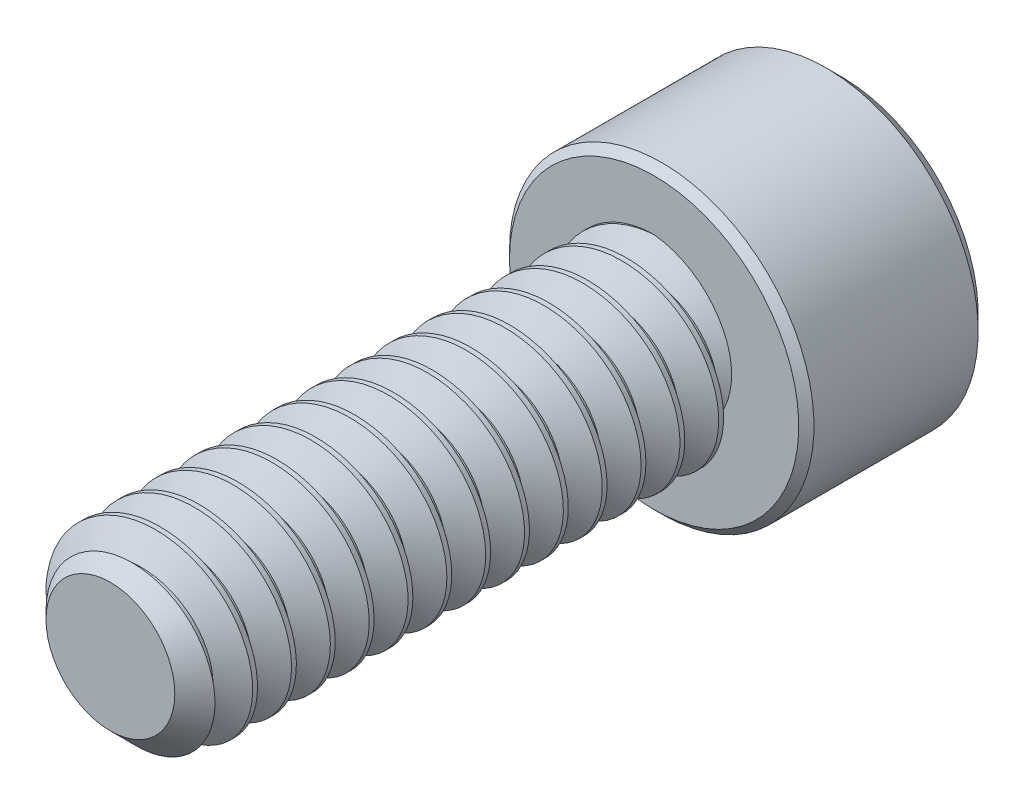
from build123d import *

# Parameters (mm, degrees)
SKETCH1_R          = 1.0922
EXTRUDE1_DEPTH     = 6.35
CHAMFER3_SIZE      = 0.340178571
CUT_SWEEP1_PITCH   = 0.453571429
SKETCH6_R          = 1.778
EXTRUDE2_DEPTH     = 2.1844
CUT_EXTRUDE1_DEPTH = 1.48828125
CHAMFER1_SIZE      = 0.1778
CHAMFER2_SIZE      = 0.0889


with BuildPart() as part:
    # Sketch1 → Extrude1 (new body)
    with BuildSketch(Plane.XY):
        Circle(SKETCH1_R)
    extrude(amount=-EXTRUDE1_DEPTH)

    # Chamfer3
    chamfer3_edges = [part.edges().sort_by_distance(p)[0] for p in [
        (-1.0922, 0, 0),
    ]]
    chamfer(chamfer3_edges, length=CHAMFER3_SIZE)

    # Cut-Sweep1: the profile of Sketch3 profile screwed along a right-hand helix of 15 turns, 6 arcs to a turn; built about Z, then put on its axis
    cut_sweep1_z = Axis((0, 0, 0), (0, 0, 1))
    cut_sweep1_corners = [(1.0925, 0, -0.397048205), (0.797596715, 0, -0.226785714), (0.797596715, 0, -0.170089286), (1.0925, 0, 0.000173205)]
    with BuildLine(mode=Mode.PRIVATE) as cut_sweep1_profile:
        Line(cut_sweep1_corners[0], cut_sweep1_corners[1])
        Line(cut_sweep1_corners[1], cut_sweep1_corners[2])
        Line(cut_sweep1_corners[2], cut_sweep1_corners[3])
        Line(cut_sweep1_corners[3], cut_sweep1_corners[0])
    cut_sweep1_cap = Face(cut_sweep1_profile.wire())
    cut_sweep1_turn_angles = [0, 30, 60, 90, 120, 150, 180, 210, 240, 270, 300, 330, 360]
    cut_sweep1_turn_weights = [1, 0.8660254037844387, 1, 0.8660254037844387, 1, 0.8660254037844387, 1, 0.8660254037844387, 1, 0.8660254037844387, 1, 0.8660254037844387, 1]
    cut_sweep1_turn_rails = [Edge.make_bspline([Vector(p[0], p[1], 0).rotate(cut_sweep1_z, cut_sweep1_turn_angles[k]) / cut_sweep1_turn_weights[k] + Vector(0, 0, p[2] + CUT_SWEEP1_PITCH * cut_sweep1_turn_angles[k] / 360) for k in range(13)], [0, 0, 0, 1, 1, 2, 2, 3, 3, 4, 4, 5, 5, 6, 6, 6], 2, cut_sweep1_turn_weights) for p in cut_sweep1_corners]
    cut_sweep1_turn_sides = [Face.make_surface_from_curves(cut_sweep1_turn_rails[p[0]], cut_sweep1_turn_rails[p[1]]) for p in [(0, 1), (1, 2), (2, 3), (3, 0)]]
    cut_sweep1 = Plane(origin=(0, 0, 0), x_dir=(0, 1, 0), z_dir=(0, 0, -1)) * Solid(Shell([*[p.moved(Location((0, 0, CUT_SWEEP1_PITCH * i))) for i in range(15) for p in cut_sweep1_turn_sides], cut_sweep1_cap, cut_sweep1_cap.rotate(cut_sweep1_z, 5400).moved(Location((0, 0, CUT_SWEEP1_PITCH * 5400 / 360)))]))
    add(cut_sweep1, mode=Mode.SUBTRACT)

    # Sketch6 → Extrude2 (add)
    with BuildSketch(Plane(origin=(0, 0, -6.35), x_dir=(-1, 0, 0), z_dir=(0, 0, -1))):
        Circle(SKETCH6_R)
    extrude(amount=EXTRUDE2_DEPTH)

    # Sketch7 → Cut-Extrude1 (cut)
    with BuildSketch(Plane(origin=(0, 0, -8.5344), x_dir=(-1, 0, 0), z_dir=(0, 0, -1))):
        Polygon((0, 1.14567944), (-0.9921875, 0.57283972), (-0.9921875, -0.57283972), (0, -1.14567944), (0.9921875, -0.57283972), (0.9921875, 0.57283972), align=None)
    extrude(amount=-CUT_EXTRUDE1_DEPTH, mode=Mode.SUBTRACT)

    # Cut-Extrude2 cone 1 section (through the dimple's axis) → Cut-Extrude2 (revolve, cut)
    with BuildSketch(Plane(origin=(0, 0, -8.5344), x_dir=(0, 1, 0), z_dir=(1, 0, 0))):
        Polygon((0, 0), (1.14567944, 0), (0, 1.14567944), align=None)
    revolve(axis=Axis((0, 0, -8.5344), (0, 0, 1)), mode=Mode.SUBTRACT)

    # Chamfer1
    chamfer1_edges = [part.edges().sort_by_distance(p)[0] for p in [
        (1.778, 0, -8.5344),
    ]]
    chamfer(chamfer1_edges, length=CHAMFER1_SIZE)

    # Chamfer2
    chamfer2_edges = [part.edges().sort_by_distance(p)[0] for p in [
        (1.778, 0, -6.35),
    ]]
    chamfer(chamfer2_edges, length=CHAMFER2_SIZE)


solid = part.part
